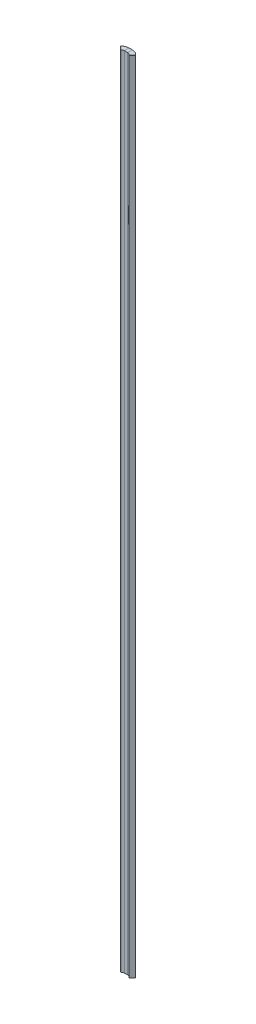
from build123d import *

# Parameters (mm, degrees)
SKETCH1_W              = 3
SKETCH1_H              = 170
BASE_FLANGE1_DEPTH     = 1
SKETCHED_START         = -85
SKETCHED_BEND1_DEPTH   = 170
SKETCHED_BEND1_2_DEPTH = 170


# Read off the part's stored shape, not the designer's step: Sketched Bend1
# Sheet-metal steps are written as plain solids
with BuildPart() as part:
    # Sketch1 → Base-Flange1 (new body)
    with BuildSketch(Plane.XY):
        Rectangle(SKETCH1_W, SKETCH1_H)
    extrude(amount=-BASE_FLANGE1_DEPTH)

    # Sketched Bend1 outline → Sketched Bend1 (cut)
    with BuildSketch(Plane(origin=(0, 0, 0), x_dir=(1, 0, 0), z_dir=(0, 1, 0)).offset(SKETCHED_START)):
        with BuildLine():
            ThreePointArc((-1.5, 0.63935721), (-1.000103552, 0.907368803), (-0.440508936, 1))
            Line((-0.440508936, 1), (-1.5, 1))
            Line((-1.5, 1), (-1.5, 0.63935721))
        make_face()
        with BuildLine():
            Line((1.5, 1), (0.258023252, 1))
            ThreePointArc((0.258023252, 1), (0.922591301, 0.867809196), (1.485984888, 0.491361636))
            Line((1.485984888, 0.491361636), (1.5, 0.477346524))
            Line((1.5, 0.477346524), (1.5, 1))
        make_face()
        Polygon((-1.301938308, 0), (-1.5, 0.198061692), (-1.5, 0), align=None)
        Polygon((1.5, 0), (1.5, 0.122473647), (1.377526353, 0), align=None)
    extrude(amount=SKETCHED_BEND1_DEPTH, mode=Mode.SUBTRACT)

    # Sketched Bend1 2 outline → Sketched Bend1 2 (add)
    with BuildSketch(Plane(origin=(0, 0, 0), x_dir=(1, 0, 0), z_dir=(0, 1, 0)).offset(SKETCHED_START)):
        with BuildLine():
            Line((-1.5, 0.198061692), (-1.5, 0.63935721))
            ThreePointArc((-1.5, 0.63935721), (-1.586626572, 0.568081541), (-1.668470572, 0.491361636))
            Line((-1.668470572, 0.491361636), (-1.730885258, 0.42894695))
            Line((-1.730885258, 0.42894695), (-1.5, 0.198061692))
        make_face()
        with BuildLine():
            Line((-0.440508936, 0), (-1.301938308, 0))
            Line((-1.301938308, 0), (-1.023778477, -0.278159831))
            Line((-1.023778477, -0.278159831), (-0.961363791, -0.215745145))
            ThreePointArc((-0.961363791, -0.215745145), (-0.722393552, -0.056070336), (-0.440508936, 0))
        make_face()
        Polygon((1.677436439, 0.299910086), (1.5, 0.477346524), (1.5, 0.122473647), align=None)
        with BuildLine():
            Line((1.377526353, 0), (0.258023252, 0))
            ThreePointArc((0.258023252, 0), (0.539907869, -0.056070336), (0.778878107, -0.215745145))
            Line((0.778878107, -0.215745145), (0.970329658, -0.407196695))
            Line((0.970329658, -0.407196695), (1.377526353, 0))
        make_face()
    extrude(amount=SKETCHED_BEND1_2_DEPTH)


solid = part.part
